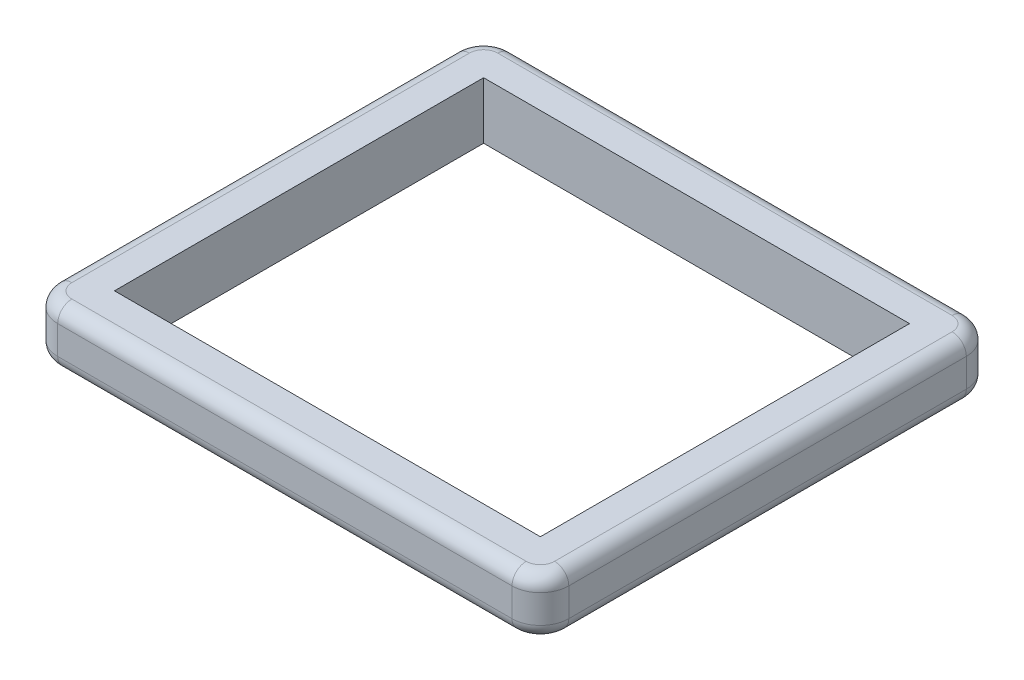
from build123d import *

# Parameters (mm, degrees)
SKETCH1_W           = 914.4
SKETCH1_H           = 812.8
SKETCH1_W_2         = 762
SKETCH1_H_2         = 660.4
BOSS_EXTRUDE1_DEPTH = 101.6
FILLET1_R           = 25.4
FILLET2_R           = 25.4
FILLET3_R           = 50.8


with BuildPart() as part:
    # Sketch1 → Boss-Extrude1 (new body)
    with BuildSketch(Plane(origin=(0, 0, 0), x_dir=(1, 0, 0), z_dir=(0, 1, 0))):
        with Locations((381, 330.2)):
            Rectangle(SKETCH1_W, SKETCH1_H)
        with Locations((381, 330.2)):
            Rectangle(SKETCH1_W_2, SKETCH1_H_2, mode=Mode.SUBTRACT)
    extrude(amount=BOSS_EXTRUDE1_DEPTH)

    # Fillet1
    fillet1_edges = [part.edges().sort_by_distance(p)[0] for p in [
        (381, 101.6, -736.6),
        (-76.2, 101.6, -330.2),
        (381, 101.6, 76.2),
        (838.2, 101.6, -330.2),
    ]]
    fillet(fillet1_edges, radius=FILLET1_R)

    # Fillet2
    fillet2_edges = [part.edges().sort_by_distance(p)[0] for p in [
        (-76.2, 0, -330.2),
        (381, 0, -736.6),
        (838.2, 0, -330.2),
        (381, 0, 76.2),
    ]]
    fillet(fillet2_edges, radius=FILLET2_R)

    # Fillet3
    # the kernel refuses this fillet: 50.8 mm, written as the material it takes off along each edge
    with BuildSketch(Plane(origin=(-25.4, 101.6, -685.8), x_dir=(0, 0, -1), z_dir=(1, 0, 0))) as fillet3_piece_1:
        with BuildLine():
            CenterArc((25.4, -25.4), 25.4, 0, 90)
            Line((50.8, -25.4), (50.8, 0))
            Line((50.8, 0), (25.4, 0))
        make_face()
    revolve(axis=Axis((-25.4, 101.6, -685.8), (0, 1, 0)), revolution_arc=90, mode=Mode.SUBTRACT)
    with BuildSketch(Plane(origin=(787.4, 101.6, -685.8), x_dir=(1, 0, 0), z_dir=(0, 0, 1))) as fillet3_piece_2:
        with BuildLine():
            CenterArc((25.4, -25.4), 25.4, 0, 90)
            Line((50.8, -25.4), (50.8, 0))
            Line((50.8, 0), (25.4, 0))
        make_face()
    revolve(axis=Axis((787.4, 101.6, -685.8), (0, 1, 0)), revolution_arc=90, mode=Mode.SUBTRACT)
    with BuildSketch(Plane(origin=(-25.4, 101.6, 25.4), x_dir=(-1, 0, 0), z_dir=(0, 0, -1))) as fillet3_piece_3:
        with BuildLine():
            CenterArc((25.4, -25.4), 25.4, 0, 90)
            Line((50.8, -25.4), (50.8, 0))
            Line((50.8, 0), (25.4, 0))
        make_face()
    revolve(axis=Axis((-25.4, 101.6, 25.4), (0, 1, 0)), revolution_arc=90, mode=Mode.SUBTRACT)
    with BuildSketch(Plane(origin=(787.4, 101.6, 25.4), x_dir=(0, 0, 1), z_dir=(-1, 0, 0))) as fillet3_piece_4:
        with BuildLine():
            CenterArc((25.4, -25.4), 25.4, 0, 90)
            Line((50.8, -25.4), (50.8, 0))
            Line((50.8, 0), (25.4, 0))
        make_face()
    revolve(axis=Axis((787.4, 101.6, 25.4), (0, 1, 0)), revolution_arc=90, mode=Mode.SUBTRACT)
    with BuildSketch(Plane(origin=(787.4, 0, 25.4), x_dir=(1, 0, 0), z_dir=(0, 0, -1))) as fillet3_piece_5:
        with BuildLine():
            CenterArc((25.4, -25.4), 25.4, 0, 90)
            Line((50.8, -25.4), (50.8, 0))
            Line((50.8, 0), (25.4, 0))
        make_face()
    revolve(axis=Axis((787.4, 0, 25.4), (0, -1, 0)), revolution_arc=90, mode=Mode.SUBTRACT)
    with BuildSketch(Plane(origin=(-25.4, 0, 25.4), x_dir=(0, 0, 1), z_dir=(1, 0, 0))) as fillet3_piece_6:
        with BuildLine():
            CenterArc((25.4, -25.4), 25.4, 0, 90)
            Line((50.8, -25.4), (50.8, 0))
            Line((50.8, 0), (25.4, 0))
        make_face()
    revolve(axis=Axis((-25.4, 0, 25.4), (0, -1, 0)), revolution_arc=90, mode=Mode.SUBTRACT)
    with BuildSketch(Plane(origin=(787.4, 0, -685.8), x_dir=(0, 0, -1), z_dir=(-1, 0, 0))) as fillet3_piece_7:
        with BuildLine():
            CenterArc((25.4, -25.4), 25.4, 0, 90)
            Line((50.8, -25.4), (50.8, 0))
            Line((50.8, 0), (25.4, 0))
        make_face()
    revolve(axis=Axis((787.4, 0, -685.8), (0, -1, 0)), revolution_arc=90, mode=Mode.SUBTRACT)
    with BuildSketch(Plane(origin=(-25.4, 0, -685.8), x_dir=(-1, 0, 0), z_dir=(0, 0, 1))) as fillet3_piece_8:
        with BuildLine():
            CenterArc((25.4, -25.4), 25.4, 0, 90)
            Line((50.8, -25.4), (50.8, 0))
            Line((50.8, 0), (25.4, 0))
        make_face()
    revolve(axis=Axis((-25.4, 0, -685.8), (0, -1, 0)), revolution_arc=90, mode=Mode.SUBTRACT)
    with BuildSketch(Plane(origin=(838.2, 0, 76.2), x_dir=(-1, 0, 0), z_dir=(0, 1, 0)), Plane(origin=(-76.2, 0, 76.2), x_dir=(0, 0, -1), z_dir=(0, 1, 0))) as fillet3_piece_9:
        with BuildLine():
            CenterArc((FILLET3_R, -FILLET3_R), FILLET3_R, 90, 90)
            Line((0, -FILLET3_R), (0, 0))
            Line((0, 0), (FILLET3_R, 0))
        make_face()
    extrude(amount=101.6, mode=Mode.SUBTRACT)
    with BuildSketch(Plane(origin=(838.2, 0, -736.6), x_dir=(-1, 0, 0), z_dir=(0, 1, 0)), Plane(origin=(-76.2, 0, -736.6), x_dir=(0, 0, 1), z_dir=(0, 1, 0))) as fillet3_piece_10:
        with BuildLine():
            CenterArc((FILLET3_R, FILLET3_R), FILLET3_R, 180, 90)
            Line((0, FILLET3_R), (0, 0))
            Line((0, 0), (FILLET3_R, 0))
        make_face()
    extrude(amount=101.6, mode=Mode.SUBTRACT)


solid = part.part
